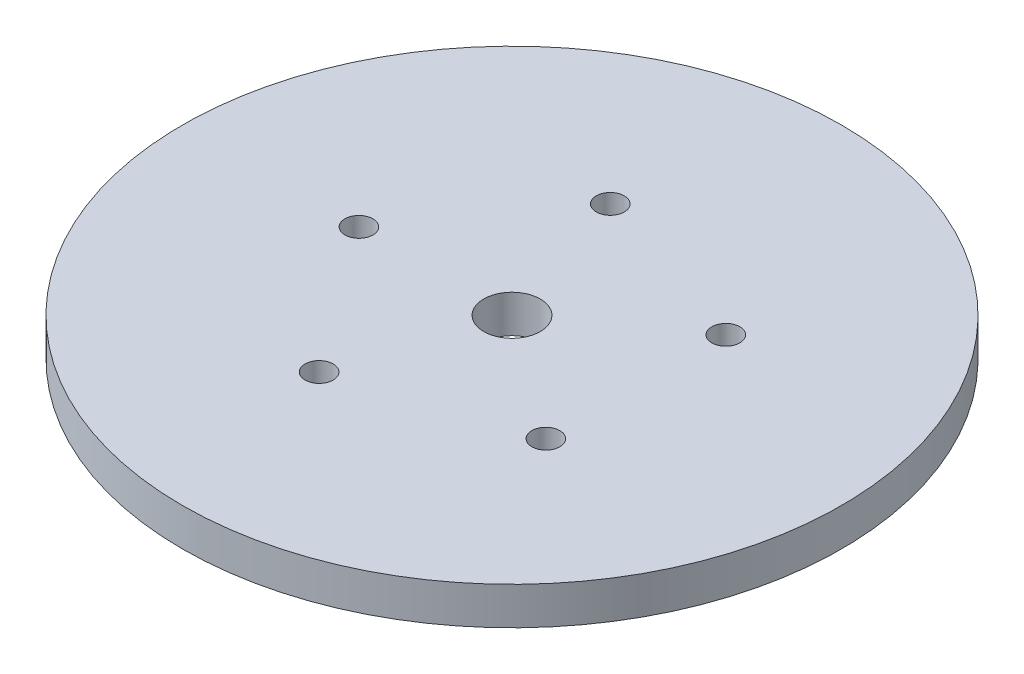
from build123d import *

# Parameters (mm, degrees)
SKETCH1_R           = 87.5
BOSS_EXTRUDE1_DEPTH = 10
SKETCH2_R           = 7.5
CUT_EXTRUDE1_DEPTH  = 125.147090179
SKETCH3_R           = 3.721577815
CUT_EXTRUDE2_DEPTH  = 8.414033674
CIRPATTERN1_COUNT   = 5


with BuildPart() as part:
    # Sketch1 → Boss-Extrude1 (new body)
    with BuildSketch(Plane(origin=(0, 0, 0), x_dir=(1, 0, 0), z_dir=(0, 1, 0))):
        Circle(SKETCH1_R)
    extrude(amount=BOSS_EXTRUDE1_DEPTH)

    # Sketch2 → Cut-Extrude1 (cut, through all)
    with BuildSketch(Plane(origin=(0, 0, 0), x_dir=(1, 0, 0), z_dir=(0, 1, 0))):
        Circle(SKETCH2_R)
    extrude(amount=CUT_EXTRUDE1_DEPTH, mode=Mode.SUBTRACT)

    # Sketch3 → Cut-Extrude2 (cut)
    with BuildSketch(Plane(origin=(0, 10, 0), x_dir=(1, 0, 0), z_dir=(0, 1, 0))):
        with Locations((-40.642213715, 0)):
            Circle(SKETCH3_R)
    cut_extrude2 = extrude(amount=-CUT_EXTRUDE2_DEPTH, mode=Mode.SUBTRACT)

    # CirPattern1: Cut-Extrude2 ×5 about axis
    cirpattern1_axis = Axis((0, 0, 0), (0, 1, 0))
    for i in range(1, CIRPATTERN1_COUNT):
        add(cut_extrude2.rotate(cirpattern1_axis, i * 360 / CIRPATTERN1_COUNT), mode=Mode.SUBTRACT)


solid = part.part
